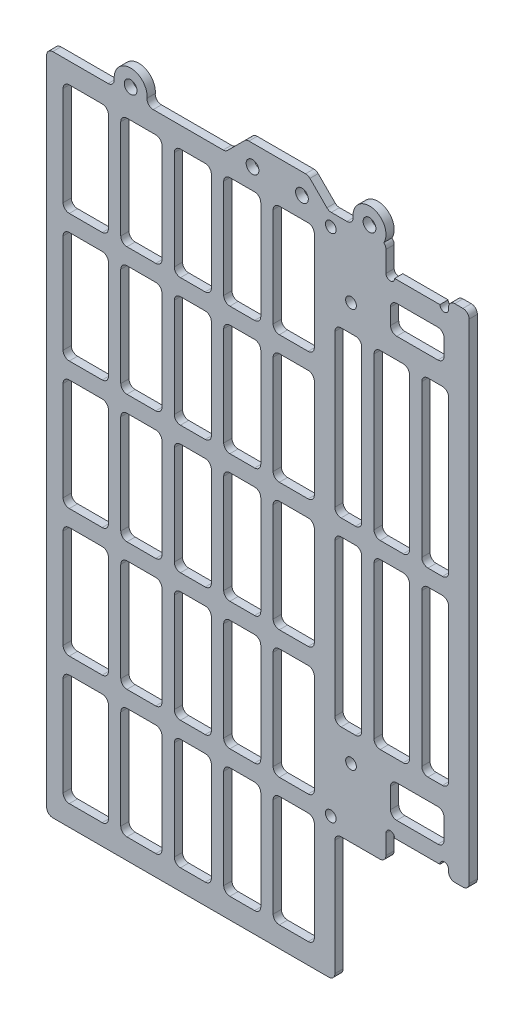
from build123d import *

# Parameters (mm, degrees)
SKETCH_1_W          = 11
SKETCH_1_H          = 27.0275
SKETCH_1_W_2        = 10
SKETCH_1_W_3        = 9
SKETCH_1_R          = 1.3
SKETCH_1_W_4        = 6.5
SKETCH_1_H_2        = 39.955
SKETCH_1_W_5        = 8.6
SKETCH_1_W_6        = 13
SKETCH_1_H_3        = 7.9
SKETCH_1_H_4        = 6.9
EXTRUDE_1_DEPTH     = 2
SKETCH_2_R          = 4
SKETCH_2_R_2        = 1.55
EXTRUDE_2_DEPTH     = 2
CUT_EXTRUDE_1_DEPTH = 10
SKETCH_3_W          = 8.461850201
SKETCH_3_H          = 4.936079284
CUT_EXTRUDE_2_DEPTH = 10
FILLET_1_DEPTH      = 2
FILLET_1_2_DEPTH    = 2


with BuildPart() as part:
    # 草图1 → 凸台-拉伸1 (new body)
    with BuildSketch(Plane.XY):
        with BuildLine():
            Line((12.6, -65.055), (12.6, 65.055))
            Line((12.6, 65.055), (7.6, 65.055))
            Line((7.6, 65.055), (7.6, 58.855))
            ThreePointArc((7.6, 58.855), (6.55, 57.805), (5.5, 58.855))
            Line((5.5, 58.855), (-5.5, 58.855))
            ThreePointArc((-5.5, 58.855), (-6.55, 57.805), (-7.6, 58.855))
            Line((-7.6, 58.855), (-7.6, 65.055))
            Line((-7.6, 65.055), (-90, 65.055))
            Line((-90, 65.055), (-90, -65.055))
            Line((-90, -65.055), (-90, -96.0825))
            Line((-90, -96.0825), (-20, -96.0825))
            Line((-20, -96.0825), (-20, -65.055))
            Line((-20, -65.055), (-7.6, -65.055))
            Line((-7.6, -65.055), (-7.6, -58.855))
            ThreePointArc((-7.6, -58.855), (-6.55, -57.805), (-5.5, -58.855))
            Line((-5.5, -58.855), (5.5, -58.855))
            ThreePointArc((5.5, -58.855), (6.55, -57.805), (7.6, -58.855))
            Line((7.6, -58.855), (7.6, -65.055))
            Line((7.6, -65.055), (12.6, -65.055))
        make_face()
        with Locations((-80.5, -77.56875)):
            Rectangle(SKETCH_1_W, SKETCH_1_H, mode=Mode.SUBTRACT)
        with Locations((-67, -77.56875)):
            Rectangle(SKETCH_1_W_2, SKETCH_1_H, mode=Mode.SUBTRACT)
        with Locations((-54.5, -77.56875)):
            Rectangle(SKETCH_1_W_3, SKETCH_1_H, mode=Mode.SUBTRACT)
        with Locations((-42.5, -77.56875)):
            Rectangle(SKETCH_1_W_3, SKETCH_1_H, mode=Mode.SUBTRACT)
        with Locations((-80.5, -46.54125)):
            Rectangle(SKETCH_1_W, SKETCH_1_H, mode=Mode.SUBTRACT)
        with Locations((-67, -46.54125)):
            Rectangle(SKETCH_1_W_2, SKETCH_1_H, mode=Mode.SUBTRACT)
        with Locations((-67, -15.51375)):
            Rectangle(SKETCH_1_W_2, SKETCH_1_H, mode=Mode.SUBTRACT)
        with Locations((-54.5, -46.54125)):
            Rectangle(SKETCH_1_W_3, SKETCH_1_H, mode=Mode.SUBTRACT)
        with Locations((-42.5, -46.54125)):
            Rectangle(SKETCH_1_W_3, SKETCH_1_H, mode=Mode.SUBTRACT)
        with Locations((-54.5, -15.51375)):
            Rectangle(SKETCH_1_W_3, SKETCH_1_H, mode=Mode.SUBTRACT)
        with Locations((-42.5, -15.51375)):
            Rectangle(SKETCH_1_W_3, SKETCH_1_H, mode=Mode.SUBTRACT)
        with Locations((-30, -77.56875)):
            Rectangle(SKETCH_1_W_2, SKETCH_1_H, mode=Mode.SUBTRACT)
        with Locations((-21, -61.955)):
            Circle(SKETCH_1_R, mode=Mode.SUBTRACT)
        with Locations((-30, -46.54125)):
            Rectangle(SKETCH_1_W_2, SKETCH_1_H, mode=Mode.SUBTRACT)
        with Locations((-16.086933305, -48.456460197)):
            Circle(SKETCH_1_R, mode=Mode.SUBTRACT)
        with Locations((-30, -15.51375)):
            Rectangle(SKETCH_1_W_2, SKETCH_1_H, mode=Mode.SUBTRACT)
        with Locations((-16.75, -21.9775)):
            Rectangle(SKETCH_1_W_4, SKETCH_1_H_2, mode=Mode.SUBTRACT)
        with Locations((-6.2, -21.9775)):
            Rectangle(SKETCH_1_W_5, SKETCH_1_H_2, mode=Mode.SUBTRACT)
        with Locations((0, -50.905)):
            Rectangle(SKETCH_1_W_6, SKETCH_1_H_3, mode=Mode.SUBTRACT)
        with Locations((4.35, -21.9775)):
            Rectangle(SKETCH_1_W_4, SKETCH_1_H_2, mode=Mode.SUBTRACT)
        with Locations((-80.5, -15.51375)):
            Rectangle(SKETCH_1_W, SKETCH_1_H, mode=Mode.SUBTRACT)
        with Locations((-80.5, 15.51375)):
            Rectangle(SKETCH_1_W, SKETCH_1_H, mode=Mode.SUBTRACT)
        with Locations((-67, 15.51375)):
            Rectangle(SKETCH_1_W_2, SKETCH_1_H, mode=Mode.SUBTRACT)
        with Locations((-54.5, 15.51375)):
            Rectangle(SKETCH_1_W_3, SKETCH_1_H, mode=Mode.SUBTRACT)
        with Locations((-42.5, 15.51375)):
            Rectangle(SKETCH_1_W_3, SKETCH_1_H, mode=Mode.SUBTRACT)
        with Locations((-80.5, 46.54125)):
            Rectangle(SKETCH_1_W, SKETCH_1_H, mode=Mode.SUBTRACT)
        with Locations((-67, 46.54125)):
            Rectangle(SKETCH_1_W_2, SKETCH_1_H, mode=Mode.SUBTRACT)
        with Locations((-54.5, 46.54125)):
            Rectangle(SKETCH_1_W_3, SKETCH_1_H, mode=Mode.SUBTRACT)
        with Locations((-42.5, 46.54125)):
            Rectangle(SKETCH_1_W_3, SKETCH_1_H, mode=Mode.SUBTRACT)
        with Locations((-30, 15.51375)):
            Rectangle(SKETCH_1_W_2, SKETCH_1_H, mode=Mode.SUBTRACT)
        with Locations((-16.75, 21.9775)):
            Rectangle(SKETCH_1_W_4, SKETCH_1_H_2, mode=Mode.SUBTRACT)
        with Locations((-6.2, 21.9775)):
            Rectangle(SKETCH_1_W_5, SKETCH_1_H_2, mode=Mode.SUBTRACT)
        with Locations((4.35, 21.9775)):
            Rectangle(SKETCH_1_W_4, SKETCH_1_H_2, mode=Mode.SUBTRACT)
        with Locations((-30, 46.54125)):
            Rectangle(SKETCH_1_W_2, SKETCH_1_H, mode=Mode.SUBTRACT)
        with Locations((-21, 61.955)):
            Circle(SKETCH_1_R, mode=Mode.SUBTRACT)
        with Locations((-16.086933305, 48.456460197)):
            Circle(SKETCH_1_R, mode=Mode.SUBTRACT)
        with Locations((0, 50.405)):
            Rectangle(SKETCH_1_W_6, SKETCH_1_H_4, mode=Mode.SUBTRACT)
    extrude(amount=EXTRUDE_1_DEPTH)

    # 草图2 → 凸台-拉伸2 (add)
    # profile 1 of 3: a face of its own
    with BuildSketch(Plane.XY.offset(2)):
        with BuildLine():
            Line((-26.45, 65.055), (-21.5, 65.055))
            Line((-21.5, 65.055), (-26.5, 70.055))
            Line((-26.5, 70.055), (-41.5, 70.055))
            Line((-41.5, 70.055), (-46.5, 65.055))
            Line((-46.5, 65.055), (-41.55, 65.055))
            ThreePointArc((-41.55, 65.055), (-40, 66.605), (-38.45, 65.055))
            Line((-38.45, 65.055), (-29.55, 65.055))
            ThreePointArc((-29.55, 65.055), (-28, 66.605), (-26.45, 65.055))
        make_face()
    # profile 2 of 3: a face of its own
    with BuildSketch(Plane.XY.offset(2)):
        with Locations((-11.6, 67.055)):
            Circle(SKETCH_2_R)
        with Locations((-11.6, 67.055)):
            Circle(SKETCH_2_R_2, mode=Mode.SUBTRACT)
    # profile 3 of 3: a face of its own
    with BuildSketch(Plane.XY.offset(2)):
        with Locations((-69.6, 67.055)):
            Circle(SKETCH_2_R)
        with Locations((-69.6, 67.055)):
            Circle(SKETCH_2_R_2, mode=Mode.SUBTRACT)
    extrude(amount=-EXTRUDE_2_DEPTH)

    # 草图2<3> → 切除-拉伸1 (cut)
    with BuildSketch(Plane.XY.offset(2)):
        with BuildLine():
            ThreePointArc((-29.55, 65.055), (-28, 63.505), (-26.45, 65.055))
            Line((-26.45, 65.055), (-29.55, 65.055))
        make_face()
        with BuildLine():
            Line((-29.55, 65.055), (-26.45, 65.055))
            ThreePointArc((-26.45, 65.055), (-28, 66.605), (-29.55, 65.055))
        make_face()
        with BuildLine():
            ThreePointArc((-41.55, 65.055), (-40, 63.505), (-38.45, 65.055))
            Line((-38.45, 65.055), (-41.55, 65.055))
        make_face()
        with BuildLine():
            Line((-41.55, 65.055), (-38.45, 65.055))
            ThreePointArc((-38.45, 65.055), (-40, 66.605), (-41.55, 65.055))
        make_face()
    extrude(amount=-CUT_EXTRUDE_1_DEPTH, mode=Mode.SUBTRACT)

    # 草图3 → 切除-拉伸2 (cut)
    with BuildSketch(Plane.XY.offset(2)):
        with Locations((9.907019496, 63.323039642)):
            Rectangle(SKETCH_3_W, SKETCH_3_H)
        with Locations((9.907019496, -63.323039642)):
            Rectangle(SKETCH_3_W, SKETCH_3_H)
    extrude(amount=-CUT_EXTRUDE_2_DEPTH, mode=Mode.SUBTRACT)

    # 圆角1: read off the stored shape, not the designer's step
    # 圆角1 outline → 圆角1 (cut)
    with BuildSketch(Plane.XY):
        with BuildLine():
            ThreePointArc((7.6, 59.355), (8.039339828, 60.415660172), (9.1, 60.855))
            Line((9.1, 60.855), (7.6, 60.855))
            Line((7.6, 60.855), (7.6, 59.355))
        make_face()
        with BuildLine():
            Line((7.6, -60.855), (9.1, -60.855))
            ThreePointArc((9.1, -60.855), (8.039339828, -60.415660172), (7.6, -59.355))
            Line((7.6, -59.355), (7.6, -60.855))
        make_face()
        with BuildLine():
            Line((12.6, -60.855), (12.6, -59.355))
            ThreePointArc((12.6, -59.355), (12.160660172, -60.415660172), (11.1, -60.855))
            Line((11.1, -60.855), (12.6, -60.855))
        make_face()
        with BuildLine():
            ThreePointArc((11.1, 60.855), (12.160660172, 60.415660172), (12.6, 59.355))
            Line((12.6, 59.355), (12.6, 60.855))
            Line((12.6, 60.855), (11.1, 60.855))
        make_face()
        with BuildLine():
            Line((-7.6, 65.055), (-8.135898385, 65.055))
            ThreePointArc((-8.135898385, 65.055), (-7.740560332, 64.539840976), (-7.6, 63.90586638))
            Line((-7.6, 63.90586638), (-7.6, 65.055))
        make_face()
        with BuildLine():
            Line((-26.5, 70.055), (-27.121320344, 70.055))
            ThreePointArc((-27.121320344, 70.055), (-26.547295195, 69.940819299), (-26.060660172, 69.615660172))
            Line((-26.060660172, 69.615660172), (-26.5, 70.055))
        make_face()
        with BuildLine():
            Line((-41.5, 70.055), (-41.939339828, 69.615660172))
            ThreePointArc((-41.939339828, 69.615660172), (-41.452704805, 69.940819299), (-40.878679656, 70.055))
            Line((-40.878679656, 70.055), (-41.5, 70.055))
        make_face()
        with BuildLine():
            Line((-90, 65.055), (-90, 63.555))
            ThreePointArc((-90, 63.555), (-89.560660172, 64.615660172), (-88.5, 65.055))
            Line((-88.5, 65.055), (-90, 65.055))
        make_face()
        with BuildLine():
            Line((-90, -96.0825), (-88.5, -96.0825))
            ThreePointArc((-88.5, -96.0825), (-89.560660172, -95.643160172), (-90, -94.5825))
            Line((-90, -94.5825), (-90, -96.0825))
        make_face()
        with BuildLine():
            Line((-20, -96.0825), (-20, -94.5825))
            ThreePointArc((-20, -94.5825), (-20.439339828, -95.643160172), (-21.5, -96.0825))
            Line((-21.5, -96.0825), (-20, -96.0825))
        make_face()
        with BuildLine():
            ThreePointArc((-7.6, -63.555), (-8.039339828, -64.615660172), (-9.1, -65.055))
            Line((-9.1, -65.055), (-7.6, -65.055))
            Line((-7.6, -65.055), (-7.6, -63.555))
        make_face()
    extrude(amount=FILLET_1_DEPTH, mode=Mode.SUBTRACT)

    # Fillet 1 2 outline → Fillet 1 2 (add)
    with BuildSketch(Plane.XY):
        with BuildLine():
            ThreePointArc((-15.583436782, 66.691363636), (-15.969402156, 65.543700206), (-17.077225575, 65.055))
            Line((-17.077225575, 65.055), (-15.064101615, 65.055))
            ThreePointArc((-15.064101615, 65.055), (-15.412594724, 65.844991128), (-15.583436782, 66.691363636))
        make_face()
        with BuildLine():
            ThreePointArc((-20.878679656, 65.055), (-21.452704805, 65.169180701), (-21.939339828, 65.494339828))
            Line((-21.939339828, 65.494339828), (-21.5, 65.055))
            Line((-21.5, 65.055), (-20.878679656, 65.055))
        make_face()
        with BuildLine():
            ThreePointArc((-46.060660172, 65.494339828), (-46.547295195, 65.169180701), (-47.121320344, 65.055))
            Line((-47.121320344, 65.055), (-46.5, 65.055))
            Line((-46.5, 65.055), (-46.060660172, 65.494339828))
        make_face()
        with BuildLine():
            ThreePointArc((-64.122774425, 65.055), (-65.230597844, 65.543700206), (-65.616563218, 66.691363636))
            ThreePointArc((-65.616563218, 66.691363636), (-65.787405276, 65.844991128), (-66.135898385, 65.055))
            Line((-66.135898385, 65.055), (-64.122774425, 65.055))
        make_face()
        with BuildLine():
            ThreePointArc((-73.583436782, 66.691363636), (-73.969402156, 65.543700206), (-75.077225575, 65.055))
            Line((-75.077225575, 65.055), (-73.064101615, 65.055))
            ThreePointArc((-73.064101615, 65.055), (-73.412594724, 65.844991128), (-73.583436782, 66.691363636))
        make_face()
        with BuildLine():
            ThreePointArc((-20, -66.555), (-19.560660172, -65.494339828), (-18.5, -65.055))
            Line((-18.5, -65.055), (-20, -65.055))
            Line((-20, -65.055), (-20, -66.555))
        make_face()
        with BuildLine():
            Line((-86, -91.0825), (-84.5, -91.0825))
            ThreePointArc((-84.5, -91.0825), (-85.560660172, -90.643160172), (-86, -89.5825))
            Line((-86, -89.5825), (-86, -91.0825))
        make_face()
        with BuildLine():
            ThreePointArc((-75, -89.5825), (-75.439339828, -90.643160172), (-76.5, -91.0825))
            Line((-76.5, -91.0825), (-75, -91.0825))
            Line((-75, -91.0825), (-75, -89.5825))
        make_face()
        with BuildLine():
            Line((-86, -64.055), (-86, -65.555))
            ThreePointArc((-86, -65.555), (-85.560660172, -64.494339828), (-84.5, -64.055))
            Line((-84.5, -64.055), (-86, -64.055))
        make_face()
        with BuildLine():
            ThreePointArc((-76.5, -64.055), (-75.439339828, -64.494339828), (-75, -65.555))
            Line((-75, -65.555), (-75, -64.055))
            Line((-75, -64.055), (-76.5, -64.055))
        make_face()
        with BuildLine():
            Line((-86, -60.055), (-84.5, -60.055))
            ThreePointArc((-84.5, -60.055), (-85.560660172, -59.615660172), (-86, -58.555))
            Line((-86, -58.555), (-86, -60.055))
        make_face()
        with BuildLine():
            ThreePointArc((-75, -58.555), (-75.439339828, -59.615660172), (-76.5, -60.055))
            Line((-76.5, -60.055), (-75, -60.055))
            Line((-75, -60.055), (-75, -58.555))
        make_face()
        with BuildLine():
            Line((-86, -33.0275), (-86, -34.5275))
            ThreePointArc((-86, -34.5275), (-85.560660172, -33.466839828), (-84.5, -33.0275))
            Line((-84.5, -33.0275), (-86, -33.0275))
        make_face()
        with BuildLine():
            ThreePointArc((-76.5, -33.0275), (-75.439339828, -33.466839828), (-75, -34.5275))
            Line((-75, -34.5275), (-75, -33.0275))
            Line((-75, -33.0275), (-76.5, -33.0275))
        make_face()
        with BuildLine():
            Line((-86, -29.0275), (-84.5, -29.0275))
            ThreePointArc((-84.5, -29.0275), (-85.560660172, -28.588160172), (-86, -27.5275))
            Line((-86, -27.5275), (-86, -29.0275))
        make_face()
        with BuildLine():
            ThreePointArc((-75, -27.5275), (-75.439339828, -28.588160172), (-76.5, -29.0275))
            Line((-76.5, -29.0275), (-75, -29.0275))
            Line((-75, -29.0275), (-75, -27.5275))
        make_face()
        with BuildLine():
            Line((-86, -2), (-86, -3.5))
            ThreePointArc((-86, -3.5), (-85.560660172, -2.439339828), (-84.5, -2))
            Line((-84.5, -2), (-86, -2))
        make_face()
        with BuildLine():
            ThreePointArc((-76.5, -2), (-75.439339828, -2.439339828), (-75, -3.5))
            Line((-75, -3.5), (-75, -2))
            Line((-75, -2), (-76.5, -2))
        make_face()
        with BuildLine():
            Line((-86, 2), (-84.5, 2))
            ThreePointArc((-84.5, 2), (-85.560660172, 2.439339828), (-86, 3.5))
            Line((-86, 3.5), (-86, 2))
        make_face()
        with BuildLine():
            ThreePointArc((-75, 3.5), (-75.439339828, 2.439339828), (-76.5, 2))
            Line((-76.5, 2), (-75, 2))
            Line((-75, 2), (-75, 3.5))
        make_face()
        with BuildLine():
            Line((-86, 29.0275), (-86, 27.5275))
            ThreePointArc((-86, 27.5275), (-85.560660172, 28.588160172), (-84.5, 29.0275))
            Line((-84.5, 29.0275), (-86, 29.0275))
        make_face()
        with BuildLine():
            ThreePointArc((-76.5, 29.0275), (-75.439339828, 28.588160172), (-75, 27.5275))
            Line((-75, 27.5275), (-75, 29.0275))
            Line((-75, 29.0275), (-76.5, 29.0275))
        make_face()
        with BuildLine():
            Line((-1.9, -41.955), (-1.9, -40.455))
            ThreePointArc((-1.9, -40.455), (-2.339339828, -41.515660172), (-3.4, -41.955))
            Line((-3.4, -41.955), (-1.9, -41.955))
        make_face()
        with BuildLine():
            ThreePointArc((-3.4, -2), (-2.339339828, -2.439339828), (-1.9, -3.5))
            Line((-1.9, -3.5), (-1.9, -2))
            Line((-1.9, -2), (-3.4, -2))
        make_face()
        with BuildLine():
            Line((-10.5, -41.955), (-9, -41.955))
            ThreePointArc((-9, -41.955), (-10.060660172, -41.515660172), (-10.5, -40.455))
            Line((-10.5, -40.455), (-10.5, -41.955))
        make_face()
        with BuildLine():
            ThreePointArc((-10.5, -3.5), (-10.060660172, -2.439339828), (-9, -2))
            Line((-9, -2), (-10.5, -2))
            Line((-10.5, -2), (-10.5, -3.5))
        make_face()
        with BuildLine():
            Line((-38, -60.055), (-38, -58.555))
            ThreePointArc((-38, -58.555), (-38.439339828, -59.615660172), (-39.5, -60.055))
            Line((-39.5, -60.055), (-38, -60.055))
        make_face()
        with BuildLine():
            ThreePointArc((-39.5, -33.0275), (-38.439339828, -33.466839828), (-38, -34.5275))
            Line((-38, -34.5275), (-38, -33.0275))
            Line((-38, -33.0275), (-39.5, -33.0275))
        make_face()
        with BuildLine():
            Line((-47, -60.055), (-45.5, -60.055))
            ThreePointArc((-45.5, -60.055), (-46.560660172, -59.615660172), (-47, -58.555))
            Line((-47, -58.555), (-47, -60.055))
        make_face()
        with BuildLine():
            ThreePointArc((-47, -34.5275), (-46.560660172, -33.466839828), (-45.5, -33.0275))
            Line((-45.5, -33.0275), (-47, -33.0275))
            Line((-47, -33.0275), (-47, -34.5275))
        make_face()
        with BuildLine():
            Line((-50, -60.055), (-50, -58.555))
            ThreePointArc((-50, -58.555), (-50.439339828, -59.615660172), (-51.5, -60.055))
            Line((-51.5, -60.055), (-50, -60.055))
        make_face()
        with BuildLine():
            ThreePointArc((-51.5, -33.0275), (-50.439339828, -33.466839828), (-50, -34.5275))
            Line((-50, -34.5275), (-50, -33.0275))
            Line((-50, -33.0275), (-51.5, -33.0275))
        make_face()
        with BuildLine():
            Line((-59, -60.055), (-57.5, -60.055))
            ThreePointArc((-57.5, -60.055), (-58.560660172, -59.615660172), (-59, -58.555))
            Line((-59, -58.555), (-59, -60.055))
        make_face()
        with BuildLine():
            ThreePointArc((-59, -34.5275), (-58.560660172, -33.466839828), (-57.5, -33.0275))
            Line((-57.5, -33.0275), (-59, -33.0275))
            Line((-59, -33.0275), (-59, -34.5275))
        make_face()
        with BuildLine():
            Line((-1.9, 41.955), (-3.4, 41.955))
            ThreePointArc((-3.4, 41.955), (-2.339339828, 41.515660172), (-1.9, 40.455))
            Line((-1.9, 40.455), (-1.9, 41.955))
        make_face()
        with BuildLine():
            ThreePointArc((-10.5, 40.455), (-10.060660172, 41.515660172), (-9, 41.955))
            Line((-9, 41.955), (-10.5, 41.955))
            Line((-10.5, 41.955), (-10.5, 40.455))
        make_face()
        with BuildLine():
            Line((-1.9, 2), (-1.9, 3.5))
            ThreePointArc((-1.9, 3.5), (-2.339339828, 2.439339828), (-3.4, 2))
            Line((-3.4, 2), (-1.9, 2))
        make_face()
        with BuildLine():
            ThreePointArc((-9, 2), (-10.060660172, 2.439339828), (-10.5, 3.5))
            Line((-10.5, 3.5), (-10.5, 2))
            Line((-10.5, 2), (-9, 2))
        make_face()
        with BuildLine():
            Line((-13.5, 41.955), (-15, 41.955))
            ThreePointArc((-15, 41.955), (-13.939339828, 41.515660172), (-13.5, 40.455))
            Line((-13.5, 40.455), (-13.5, 41.955))
        make_face()
        with BuildLine():
            ThreePointArc((-20, 40.455), (-19.560660172, 41.515660172), (-18.5, 41.955))
            Line((-18.5, 41.955), (-20, 41.955))
            Line((-20, 41.955), (-20, 40.455))
        make_face()
        with BuildLine():
            Line((-13.5, 2), (-13.5, 3.5))
            ThreePointArc((-13.5, 3.5), (-13.939339828, 2.439339828), (-15, 2))
            Line((-15, 2), (-13.5, 2))
        make_face()
        with BuildLine():
            ThreePointArc((-18.5, 2), (-19.560660172, 2.439339828), (-20, 3.5))
            Line((-20, 3.5), (-20, 2))
            Line((-20, 2), (-18.5, 2))
        make_face()
        with BuildLine():
            Line((-62, 29.0275), (-63.5, 29.0275))
            ThreePointArc((-63.5, 29.0275), (-62.439339828, 28.588160172), (-62, 27.5275))
            Line((-62, 27.5275), (-62, 29.0275))
        make_face()
        with BuildLine():
            ThreePointArc((-72, 27.5275), (-71.560660172, 28.588160172), (-70.5, 29.0275))
            Line((-70.5, 29.0275), (-72, 29.0275))
            Line((-72, 29.0275), (-72, 27.5275))
        make_face()
        with BuildLine():
            Line((-62, 2), (-62, 3.5))
            ThreePointArc((-62, 3.5), (-62.439339828, 2.439339828), (-63.5, 2))
            Line((-63.5, 2), (-62, 2))
        make_face()
        with BuildLine():
            ThreePointArc((-70.5, 2), (-71.560660172, 2.439339828), (-72, 3.5))
            Line((-72, 3.5), (-72, 2))
            Line((-72, 2), (-70.5, 2))
        make_face()
        with BuildLine():
            Line((-38, 29.0275), (-39.5, 29.0275))
            ThreePointArc((-39.5, 29.0275), (-38.439339828, 28.588160172), (-38, 27.5275))
            Line((-38, 27.5275), (-38, 29.0275))
        make_face()
        with BuildLine():
            ThreePointArc((-47, 27.5275), (-46.560660172, 28.588160172), (-45.5, 29.0275))
            Line((-45.5, 29.0275), (-47, 29.0275))
            Line((-47, 29.0275), (-47, 27.5275))
        make_face()
        with BuildLine():
            Line((-38, 2), (-38, 3.5))
            ThreePointArc((-38, 3.5), (-38.439339828, 2.439339828), (-39.5, 2))
            Line((-39.5, 2), (-38, 2))
        make_face()
        with BuildLine():
            ThreePointArc((-45.5, 2), (-46.560660172, 2.439339828), (-47, 3.5))
            Line((-47, 3.5), (-47, 2))
            Line((-47, 2), (-45.5, 2))
        make_face()
        with BuildLine():
            Line((-38, 60.055), (-39.5, 60.055))
            ThreePointArc((-39.5, 60.055), (-38.439339828, 59.615660172), (-38, 58.555))
            Line((-38, 58.555), (-38, 60.055))
        make_face()
        with BuildLine():
            ThreePointArc((-47, 58.555), (-46.560660172, 59.615660172), (-45.5, 60.055))
            Line((-45.5, 60.055), (-47, 60.055))
            Line((-47, 60.055), (-47, 58.555))
        make_face()
        with BuildLine():
            Line((-38, 33.0275), (-38, 34.5275))
            ThreePointArc((-38, 34.5275), (-38.439339828, 33.466839828), (-39.5, 33.0275))
            Line((-39.5, 33.0275), (-38, 33.0275))
        make_face()
        with BuildLine():
            ThreePointArc((-45.5, 33.0275), (-46.560660172, 33.466839828), (-47, 34.5275))
            Line((-47, 34.5275), (-47, 33.0275))
            Line((-47, 33.0275), (-45.5, 33.0275))
        make_face()
        with BuildLine():
            Line((-62, 60.055), (-63.5, 60.055))
            ThreePointArc((-63.5, 60.055), (-62.439339828, 59.615660172), (-62, 58.555))
            Line((-62, 58.555), (-62, 60.055))
        make_face()
        with BuildLine():
            ThreePointArc((-72, 58.555), (-71.560660172, 59.615660172), (-70.5, 60.055))
            Line((-70.5, 60.055), (-72, 60.055))
            Line((-72, 60.055), (-72, 58.555))
        make_face()
        with BuildLine():
            Line((-62, 33.0275), (-62, 34.5275))
            ThreePointArc((-62, 34.5275), (-62.439339828, 33.466839828), (-63.5, 33.0275))
            Line((-63.5, 33.0275), (-62, 33.0275))
        make_face()
        with BuildLine():
            ThreePointArc((-70.5, 33.0275), (-71.560660172, 33.466839828), (-72, 34.5275))
            Line((-72, 34.5275), (-72, 33.0275))
            Line((-72, 33.0275), (-70.5, 33.0275))
        make_face()
        with BuildLine():
            Line((6.5, -54.855), (6.5, -53.355))
            ThreePointArc((6.5, -53.355), (6.060660172, -54.415660172), (5, -54.855))
            Line((5, -54.855), (6.5, -54.855))
        make_face()
        with BuildLine():
            ThreePointArc((5, -46.955), (6.060660172, -47.394339828), (6.5, -48.455))
            Line((6.5, -48.455), (6.5, -46.955))
            Line((6.5, -46.955), (5, -46.955))
        make_face()
        with BuildLine():
            Line((-6.5, -54.855), (-5, -54.855))
            ThreePointArc((-5, -54.855), (-6.060660172, -54.415660172), (-6.5, -53.355))
            Line((-6.5, -53.355), (-6.5, -54.855))
        make_face()
        with BuildLine():
            ThreePointArc((-6.5, -48.455), (-6.060660172, -47.394339828), (-5, -46.955))
            Line((-5, -46.955), (-6.5, -46.955))
            Line((-6.5, -46.955), (-6.5, -48.455))
        make_face()
        with BuildLine():
            Line((6.5, 46.955), (6.5, 48.455))
            ThreePointArc((6.5, 48.455), (6.060660172, 47.394339828), (5, 46.955))
            Line((5, 46.955), (6.5, 46.955))
        make_face()
        with BuildLine():
            ThreePointArc((5, 53.855), (6.060660172, 53.415660172), (6.5, 52.355))
            Line((6.5, 52.355), (6.5, 53.855))
            Line((6.5, 53.855), (5, 53.855))
        make_face()
        with BuildLine():
            Line((-6.5, 46.955), (-5, 46.955))
            ThreePointArc((-5, 46.955), (-6.060660172, 47.394339828), (-6.5, 48.455))
            Line((-6.5, 48.455), (-6.5, 46.955))
        make_face()
        with BuildLine():
            ThreePointArc((-6.5, 52.355), (-6.060660172, 53.415660172), (-5, 53.855))
            Line((-5, 53.855), (-6.5, 53.855))
            Line((-6.5, 53.855), (-6.5, 52.355))
        make_face()
        with BuildLine():
            Line((1.1, 2), (2.6, 2))
            ThreePointArc((2.6, 2), (1.539339828, 2.439339828), (1.1, 3.5))
            Line((1.1, 3.5), (1.1, 2))
        make_face()
        with BuildLine():
            ThreePointArc((7.6, 3.5), (7.160660172, 2.439339828), (6.1, 2))
            Line((6.1, 2), (7.6, 2))
            Line((7.6, 2), (7.6, 3.5))
        make_face()
        with BuildLine():
            Line((1.1, 41.955), (1.1, 40.455))
            ThreePointArc((1.1, 40.455), (1.539339828, 41.515660172), (2.6, 41.955))
            Line((2.6, 41.955), (1.1, 41.955))
        make_face()
        with BuildLine():
            ThreePointArc((6.1, 41.955), (7.160660172, 41.515660172), (7.6, 40.455))
            Line((7.6, 40.455), (7.6, 41.955))
            Line((7.6, 41.955), (6.1, 41.955))
        make_face()
        with BuildLine():
            Line((-35, 33.0275), (-33.5, 33.0275))
            ThreePointArc((-33.5, 33.0275), (-34.560660172, 33.466839828), (-35, 34.5275))
            Line((-35, 34.5275), (-35, 33.0275))
        make_face()
        with BuildLine():
            ThreePointArc((-25, 34.5275), (-25.439339828, 33.466839828), (-26.5, 33.0275))
            Line((-26.5, 33.0275), (-25, 33.0275))
            Line((-25, 33.0275), (-25, 34.5275))
        make_face()
        with BuildLine():
            Line((-35, 60.055), (-35, 58.555))
            ThreePointArc((-35, 58.555), (-34.560660172, 59.615660172), (-33.5, 60.055))
            Line((-33.5, 60.055), (-35, 60.055))
        make_face()
        with BuildLine():
            ThreePointArc((-26.5, 60.055), (-25.439339828, 59.615660172), (-25, 58.555))
            Line((-25, 58.555), (-25, 60.055))
            Line((-25, 60.055), (-26.5, 60.055))
        make_face()
        with BuildLine():
            Line((-35, 2), (-33.5, 2))
            ThreePointArc((-33.5, 2), (-34.560660172, 2.439339828), (-35, 3.5))
            Line((-35, 3.5), (-35, 2))
        make_face()
        with BuildLine():
            ThreePointArc((-25, 3.5), (-25.439339828, 2.439339828), (-26.5, 2))
            Line((-26.5, 2), (-25, 2))
            Line((-25, 2), (-25, 3.5))
        make_face()
        with BuildLine():
            Line((-35, 29.0275), (-35, 27.5275))
            ThreePointArc((-35, 27.5275), (-34.560660172, 28.588160172), (-33.5, 29.0275))
            Line((-33.5, 29.0275), (-35, 29.0275))
        make_face()
        with BuildLine():
            ThreePointArc((-26.5, 29.0275), (-25.439339828, 28.588160172), (-25, 27.5275))
            Line((-25, 27.5275), (-25, 29.0275))
            Line((-25, 29.0275), (-26.5, 29.0275))
        make_face()
        with BuildLine():
            ThreePointArc((-59, 58.555), (-58.560660172, 59.615660172), (-57.5, 60.055))
            Line((-57.5, 60.055), (-59, 60.055))
            Line((-59, 60.055), (-59, 58.555))
        make_face()
        with BuildLine():
            Line((-50, 60.055), (-51.5, 60.055))
            ThreePointArc((-51.5, 60.055), (-50.439339828, 59.615660172), (-50, 58.555))
            Line((-50, 58.555), (-50, 60.055))
        make_face()
        with BuildLine():
            ThreePointArc((-57.5, 33.0275), (-58.560660172, 33.466839828), (-59, 34.5275))
            Line((-59, 34.5275), (-59, 33.0275))
            Line((-59, 33.0275), (-57.5, 33.0275))
        make_face()
        with BuildLine():
            Line((-50, 33.0275), (-50, 34.5275))
            ThreePointArc((-50, 34.5275), (-50.439339828, 33.466839828), (-51.5, 33.0275))
            Line((-51.5, 33.0275), (-50, 33.0275))
        make_face()
        with BuildLine():
            ThreePointArc((-59, 27.5275), (-58.560660172, 28.588160172), (-57.5, 29.0275))
            Line((-57.5, 29.0275), (-59, 29.0275))
            Line((-59, 29.0275), (-59, 27.5275))
        make_face()
        with BuildLine():
            Line((-50, 29.0275), (-51.5, 29.0275))
            ThreePointArc((-51.5, 29.0275), (-50.439339828, 28.588160172), (-50, 27.5275))
            Line((-50, 27.5275), (-50, 29.0275))
        make_face()
        with BuildLine():
            ThreePointArc((-57.5, 2), (-58.560660172, 2.439339828), (-59, 3.5))
            Line((-59, 3.5), (-59, 2))
            Line((-59, 2), (-57.5, 2))
        make_face()
        with BuildLine():
            Line((-50, 2), (-50, 3.5))
            ThreePointArc((-50, 3.5), (-50.439339828, 2.439339828), (-51.5, 2))
            Line((-51.5, 2), (-50, 2))
        make_face()
        with BuildLine():
            Line((-72, -29.0275), (-70.5, -29.0275))
            ThreePointArc((-70.5, -29.0275), (-71.560660172, -28.588160172), (-72, -27.5275))
            Line((-72, -27.5275), (-72, -29.0275))
        make_face()
        with BuildLine():
            ThreePointArc((-62, -27.5275), (-62.439339828, -28.588160172), (-63.5, -29.0275))
            Line((-63.5, -29.0275), (-62, -29.0275))
            Line((-62, -29.0275), (-62, -27.5275))
        make_face()
        with BuildLine():
            Line((-72, -2), (-72, -3.5))
            ThreePointArc((-72, -3.5), (-71.560660172, -2.439339828), (-70.5, -2))
            Line((-70.5, -2), (-72, -2))
        make_face()
        with BuildLine():
            ThreePointArc((-63.5, -2), (-62.439339828, -2.439339828), (-62, -3.5))
            Line((-62, -3.5), (-62, -2))
            Line((-62, -2), (-63.5, -2))
        make_face()
        with BuildLine():
            Line((-72, -60.055), (-70.5, -60.055))
            ThreePointArc((-70.5, -60.055), (-71.560660172, -59.615660172), (-72, -58.555))
            Line((-72, -58.555), (-72, -60.055))
        make_face()
        with BuildLine():
            ThreePointArc((-62, -58.555), (-62.439339828, -59.615660172), (-63.5, -60.055))
            Line((-63.5, -60.055), (-62, -60.055))
            Line((-62, -60.055), (-62, -58.555))
        make_face()
        with BuildLine():
            Line((-72, -33.0275), (-72, -34.5275))
            ThreePointArc((-72, -34.5275), (-71.560660172, -33.466839828), (-70.5, -33.0275))
            Line((-70.5, -33.0275), (-72, -33.0275))
        make_face()
        with BuildLine():
            ThreePointArc((-63.5, -33.0275), (-62.439339828, -33.466839828), (-62, -34.5275))
            Line((-62, -34.5275), (-62, -33.0275))
            Line((-62, -33.0275), (-63.5, -33.0275))
        make_face()
        with BuildLine():
            ThreePointArc((-51.5, -2), (-50.439339828, -2.439339828), (-50, -3.5))
            Line((-50, -3.5), (-50, -2))
            Line((-50, -2), (-51.5, -2))
        make_face()
        with BuildLine():
            Line((-50, -29.0275), (-50, -27.5275))
            ThreePointArc((-50, -27.5275), (-50.439339828, -28.588160172), (-51.5, -29.0275))
            Line((-51.5, -29.0275), (-50, -29.0275))
        make_face()
        with BuildLine():
            ThreePointArc((-59, -3.5), (-58.560660172, -2.439339828), (-57.5, -2))
            Line((-57.5, -2), (-59, -2))
            Line((-59, -2), (-59, -3.5))
        make_face()
        with BuildLine():
            Line((-59, -29.0275), (-57.5, -29.0275))
            ThreePointArc((-57.5, -29.0275), (-58.560660172, -28.588160172), (-59, -27.5275))
            Line((-59, -27.5275), (-59, -29.0275))
        make_face()
        with BuildLine():
            ThreePointArc((-39.5, -2), (-38.439339828, -2.439339828), (-38, -3.5))
            Line((-38, -3.5), (-38, -2))
            Line((-38, -2), (-39.5, -2))
        make_face()
        with BuildLine():
            Line((-38, -29.0275), (-38, -27.5275))
            ThreePointArc((-38, -27.5275), (-38.439339828, -28.588160172), (-39.5, -29.0275))
            Line((-39.5, -29.0275), (-38, -29.0275))
        make_face()
        with BuildLine():
            ThreePointArc((-47, -3.5), (-46.560660172, -2.439339828), (-45.5, -2))
            Line((-45.5, -2), (-47, -2))
            Line((-47, -2), (-47, -3.5))
        make_face()
        with BuildLine():
            Line((-47, -29.0275), (-45.5, -29.0275))
            ThreePointArc((-45.5, -29.0275), (-46.560660172, -28.588160172), (-47, -27.5275))
            Line((-47, -27.5275), (-47, -29.0275))
        make_face()
        with BuildLine():
            Line((-35, -33.0275), (-35, -34.5275))
            ThreePointArc((-35, -34.5275), (-34.560660172, -33.466839828), (-33.5, -33.0275))
            Line((-33.5, -33.0275), (-35, -33.0275))
        make_face()
        with BuildLine():
            ThreePointArc((-33.5, -60.055), (-34.560660172, -59.615660172), (-35, -58.555))
            Line((-35, -58.555), (-35, -60.055))
            Line((-35, -60.055), (-33.5, -60.055))
        make_face()
        with BuildLine():
            Line((-25, -33.0275), (-26.5, -33.0275))
            ThreePointArc((-26.5, -33.0275), (-25.439339828, -33.466839828), (-25, -34.5275))
            Line((-25, -34.5275), (-25, -33.0275))
        make_face()
        with BuildLine():
            ThreePointArc((-25, -58.555), (-25.439339828, -59.615660172), (-26.5, -60.055))
            Line((-26.5, -60.055), (-25, -60.055))
            Line((-25, -60.055), (-25, -58.555))
        make_face()
        with BuildLine():
            Line((-35, -2), (-35, -3.5))
            ThreePointArc((-35, -3.5), (-34.560660172, -2.439339828), (-33.5, -2))
            Line((-33.5, -2), (-35, -2))
        make_face()
        with BuildLine():
            ThreePointArc((-33.5, -29.0275), (-34.560660172, -28.588160172), (-35, -27.5275))
            Line((-35, -27.5275), (-35, -29.0275))
            Line((-35, -29.0275), (-33.5, -29.0275))
        make_face()
        with BuildLine():
            Line((-25, -2), (-26.5, -2))
            ThreePointArc((-26.5, -2), (-25.439339828, -2.439339828), (-25, -3.5))
            Line((-25, -3.5), (-25, -2))
        make_face()
        with BuildLine():
            ThreePointArc((-25, -27.5275), (-25.439339828, -28.588160172), (-26.5, -29.0275))
            Line((-26.5, -29.0275), (-25, -29.0275))
            Line((-25, -29.0275), (-25, -27.5275))
        make_face()
        with BuildLine():
            Line((-20, -41.955), (-18.5, -41.955))
            ThreePointArc((-18.5, -41.955), (-19.560660172, -41.515660172), (-20, -40.455))
            Line((-20, -40.455), (-20, -41.955))
        make_face()
        with BuildLine():
            ThreePointArc((-13.5, -40.455), (-13.939339828, -41.515660172), (-15, -41.955))
            Line((-15, -41.955), (-13.5, -41.955))
            Line((-13.5, -41.955), (-13.5, -40.455))
        make_face()
        with BuildLine():
            Line((-20, -2), (-20, -3.5))
            ThreePointArc((-20, -3.5), (-19.560660172, -2.439339828), (-18.5, -2))
            Line((-18.5, -2), (-20, -2))
        make_face()
        with BuildLine():
            ThreePointArc((-15, -2), (-13.939339828, -2.439339828), (-13.5, -3.5))
            Line((-13.5, -3.5), (-13.5, -2))
            Line((-13.5, -2), (-15, -2))
        make_face()
        with BuildLine():
            Line((1.1, -2), (1.1, -3.5))
            ThreePointArc((1.1, -3.5), (1.539339828, -2.439339828), (2.6, -2))
            Line((2.6, -2), (1.1, -2))
        make_face()
        with BuildLine():
            ThreePointArc((2.6, -41.955), (1.539339828, -41.515660172), (1.1, -40.455))
            Line((1.1, -40.455), (1.1, -41.955))
            Line((1.1, -41.955), (2.6, -41.955))
        make_face()
        with BuildLine():
            Line((7.6, -2), (6.1, -2))
            ThreePointArc((6.1, -2), (7.160660172, -2.439339828), (7.6, -3.5))
            Line((7.6, -3.5), (7.6, -2))
        make_face()
        with BuildLine():
            ThreePointArc((7.6, -40.455), (7.160660172, -41.515660172), (6.1, -41.955))
            Line((6.1, -41.955), (7.6, -41.955))
            Line((7.6, -41.955), (7.6, -40.455))
        make_face()
        with BuildLine():
            Line((-75, 60.055), (-76.5, 60.055))
            ThreePointArc((-76.5, 60.055), (-75.439339828, 59.615660172), (-75, 58.555))
            Line((-75, 58.555), (-75, 60.055))
        make_face()
        with BuildLine():
            ThreePointArc((-86, 58.555), (-85.560660172, 59.615660172), (-84.5, 60.055))
            Line((-84.5, 60.055), (-86, 60.055))
            Line((-86, 60.055), (-86, 58.555))
        make_face()
        with BuildLine():
            Line((-75, 33.0275), (-75, 34.5275))
            ThreePointArc((-75, 34.5275), (-75.439339828, 33.466839828), (-76.5, 33.0275))
            Line((-76.5, 33.0275), (-75, 33.0275))
        make_face()
        with BuildLine():
            ThreePointArc((-84.5, 33.0275), (-85.560660172, 33.466839828), (-86, 34.5275))
            Line((-86, 34.5275), (-86, 33.0275))
            Line((-86, 33.0275), (-84.5, 33.0275))
        make_face()
        with BuildLine():
            Line((-35, -64.055), (-35, -65.555))
            ThreePointArc((-35, -65.555), (-34.560660172, -64.494339828), (-33.5, -64.055))
            Line((-33.5, -64.055), (-35, -64.055))
        make_face()
        with BuildLine():
            ThreePointArc((-33.5, -91.0825), (-34.560660172, -90.643160172), (-35, -89.5825))
            Line((-35, -89.5825), (-35, -91.0825))
            Line((-35, -91.0825), (-33.5, -91.0825))
        make_face()
        with BuildLine():
            Line((-25, -64.055), (-26.5, -64.055))
            ThreePointArc((-26.5, -64.055), (-25.439339828, -64.494339828), (-25, -65.555))
            Line((-25, -65.555), (-25, -64.055))
        make_face()
        with BuildLine():
            ThreePointArc((-25, -89.5825), (-25.439339828, -90.643160172), (-26.5, -91.0825))
            Line((-26.5, -91.0825), (-25, -91.0825))
            Line((-25, -91.0825), (-25, -89.5825))
        make_face()
        with BuildLine():
            ThreePointArc((-39.5, -64.055), (-38.439339828, -64.494339828), (-38, -65.555))
            Line((-38, -65.555), (-38, -64.055))
            Line((-38, -64.055), (-39.5, -64.055))
        make_face()
        with BuildLine():
            Line((-38, -91.0825), (-38, -89.5825))
            ThreePointArc((-38, -89.5825), (-38.439339828, -90.643160172), (-39.5, -91.0825))
            Line((-39.5, -91.0825), (-38, -91.0825))
        make_face()
        with BuildLine():
            ThreePointArc((-47, -65.555), (-46.560660172, -64.494339828), (-45.5, -64.055))
            Line((-45.5, -64.055), (-47, -64.055))
            Line((-47, -64.055), (-47, -65.555))
        make_face()
        with BuildLine():
            Line((-47, -91.0825), (-45.5, -91.0825))
            ThreePointArc((-45.5, -91.0825), (-46.560660172, -90.643160172), (-47, -89.5825))
            Line((-47, -89.5825), (-47, -91.0825))
        make_face()
        with BuildLine():
            ThreePointArc((-51.5, -64.055), (-50.439339828, -64.494339828), (-50, -65.555))
            Line((-50, -65.555), (-50, -64.055))
            Line((-50, -64.055), (-51.5, -64.055))
        make_face()
        with BuildLine():
            Line((-50, -91.0825), (-50, -89.5825))
            ThreePointArc((-50, -89.5825), (-50.439339828, -90.643160172), (-51.5, -91.0825))
            Line((-51.5, -91.0825), (-50, -91.0825))
        make_face()
        with BuildLine():
            ThreePointArc((-59, -65.555), (-58.560660172, -64.494339828), (-57.5, -64.055))
            Line((-57.5, -64.055), (-59, -64.055))
            Line((-59, -64.055), (-59, -65.555))
        make_face()
        with BuildLine():
            Line((-59, -91.0825), (-57.5, -91.0825))
            ThreePointArc((-57.5, -91.0825), (-58.560660172, -90.643160172), (-59, -89.5825))
            Line((-59, -89.5825), (-59, -91.0825))
        make_face()
        with BuildLine():
            ThreePointArc((-63.5, -64.055), (-62.439339828, -64.494339828), (-62, -65.555))
            Line((-62, -65.555), (-62, -64.055))
            Line((-62, -64.055), (-63.5, -64.055))
        make_face()
        with BuildLine():
            Line((-62, -91.0825), (-62, -89.5825))
            ThreePointArc((-62, -89.5825), (-62.439339828, -90.643160172), (-63.5, -91.0825))
            Line((-63.5, -91.0825), (-62, -91.0825))
        make_face()
        with BuildLine():
            ThreePointArc((-72, -65.555), (-71.560660172, -64.494339828), (-70.5, -64.055))
            Line((-70.5, -64.055), (-72, -64.055))
            Line((-72, -64.055), (-72, -65.555))
        make_face()
        with BuildLine():
            Line((-72, -91.0825), (-70.5, -91.0825))
            ThreePointArc((-70.5, -91.0825), (-71.560660172, -90.643160172), (-72, -89.5825))
            Line((-72, -89.5825), (-72, -91.0825))
        make_face()
    extrude(amount=FILLET_1_2_DEPTH)


solid = part.part
